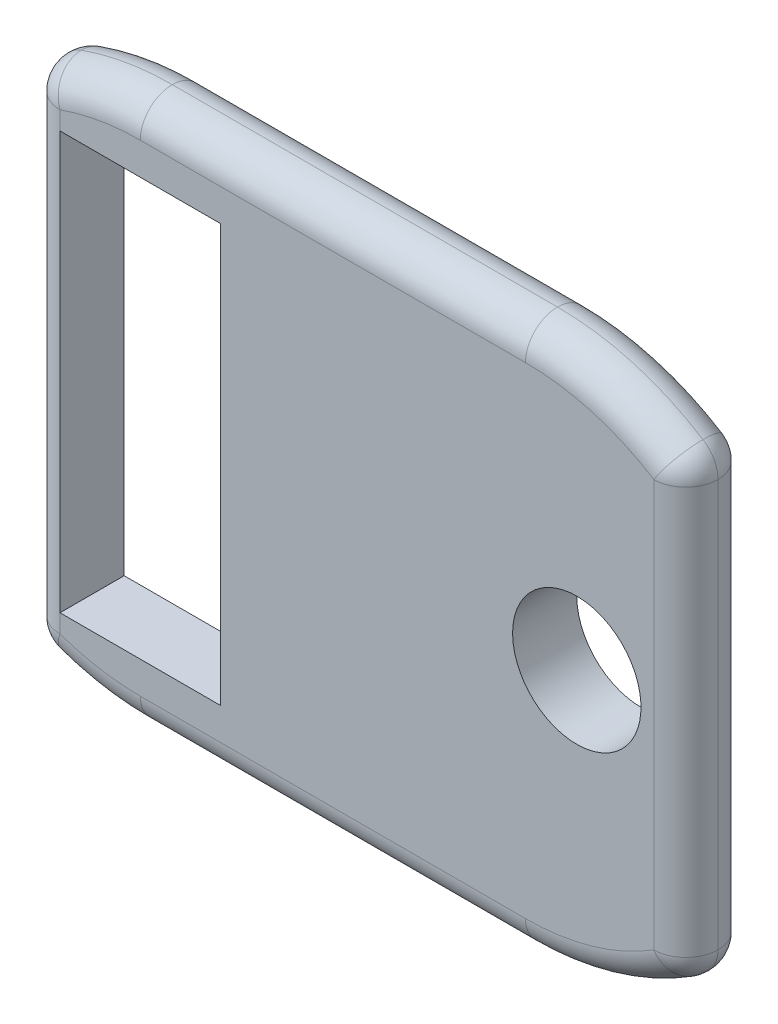
from build123d import *

# Parameters (mm, degrees)
BOSS_EXTRUDE1_DEPTH = 10
SKETCH2_W           = 25
SKETCH2_H           = 65
CUT_EXTRUDE2_DEPTH  = 20
SKETCH3_R           = 10
CUT_EXTRUDE3_DEPTH  = 20
FILLET2_R           = 5


with BuildPart() as part:
    # Sketch1 → Boss-Extrude1 (new body)
    with BuildSketch(Plane.XY):
        with BuildLine():
            Line((-51.324273213, 15.030948404), (8.675726787, 15.030948404))
            ThreePointArc((8.675726787, 15.030948404), (21.820193251, 12.947195155), (33.675726787, 6.900266117))
            Line((33.675726787, 6.900266117), (33.675726787, -61.838369308))
            ThreePointArc((33.675726787, -61.838369308), (21.820193251, -67.885298346), (8.675726787, -69.969051596))
            Line((8.675726787, -69.969051596), (-51.324273213, -69.969051596))
            ThreePointArc((-51.324273213, -69.969051596), (-60.275029546, -69.015819954), (-68.824273213, -66.198885058))
            Line((-68.824273213, -66.198885058), (-68.824273213, 11.260781867))
            ThreePointArc((-68.824273213, 11.260781867), (-60.275029546, 14.077716763), (-51.324273213, 15.030948404))
        make_face()
    extrude(amount=BOSS_EXTRUDE1_DEPTH)

    # Sketch2 → Cut-Extrude2 (cut)
    with BuildSketch(Plane(origin=(0, 0, 0), x_dir=(-1, 0, 0), z_dir=(0, 0, -1))):
        with Locations((51.324273213, -27.469051596)):
            Rectangle(SKETCH2_W, SKETCH2_H)
    extrude(amount=-CUT_EXTRUDE2_DEPTH, mode=Mode.SUBTRACT)

    # Sketch3 → Cut-Extrude3 (cut)
    with BuildSketch(Plane(origin=(0, 0, 0), x_dir=(-1, 0, 0), z_dir=(0, 0, -1))):
        with Locations((-16.675726787, -27.469051596)):
            Circle(SKETCH3_R)
    extrude(amount=-CUT_EXTRUDE3_DEPTH, mode=Mode.SUBTRACT)

    # Fillet2
    fillet2_edges = [part.edges().sort_by_distance(p)[0] for p in [
        (21.820193251, 12.947195155, 10),
        (33.675726787, -27.469051596, 0),
        (21.820193251, -67.885298346, 0),
        (-21.324273213, 15.030948404, 10),
        (8.675726787, -69.969051596, 5),
        (-51.324273213, -69.969051596, 5),
        (-68.824273213, -66.198885058, 5),
        (-68.824273213, 11.260781867, 5),
        (-51.324273213, 15.030948404, 5),
        (8.675726787, 15.030948404, 5),
        (33.675726787, 6.900266117, 5),
        (33.675726787, -61.838369308, 5),
        (-60.275029546, 14.077716763, 10),
        (-68.824273213, -27.469051596, 10),
        (-60.275029546, -69.015819954, 10),
        (-21.324273213, -69.969051596, 10),
        (21.820193251, -67.885298346, 10),
        (33.675726787, -27.469051596, 10),
        (-21.324273213, -69.969051596, 0),
        (-60.275029546, -69.015819954, 0),
        (-68.824273213, -27.469051596, 0),
        (-60.275029546, 14.077716763, 0),
        (-21.324273213, 15.030948404, 0),
        (21.820193251, 12.947195155, 0),
    ]]
    fillet(fillet2_edges, radius=FILLET2_R - 0.0001)  # a hair under: the kernel refuses the full size


solid = part.part
